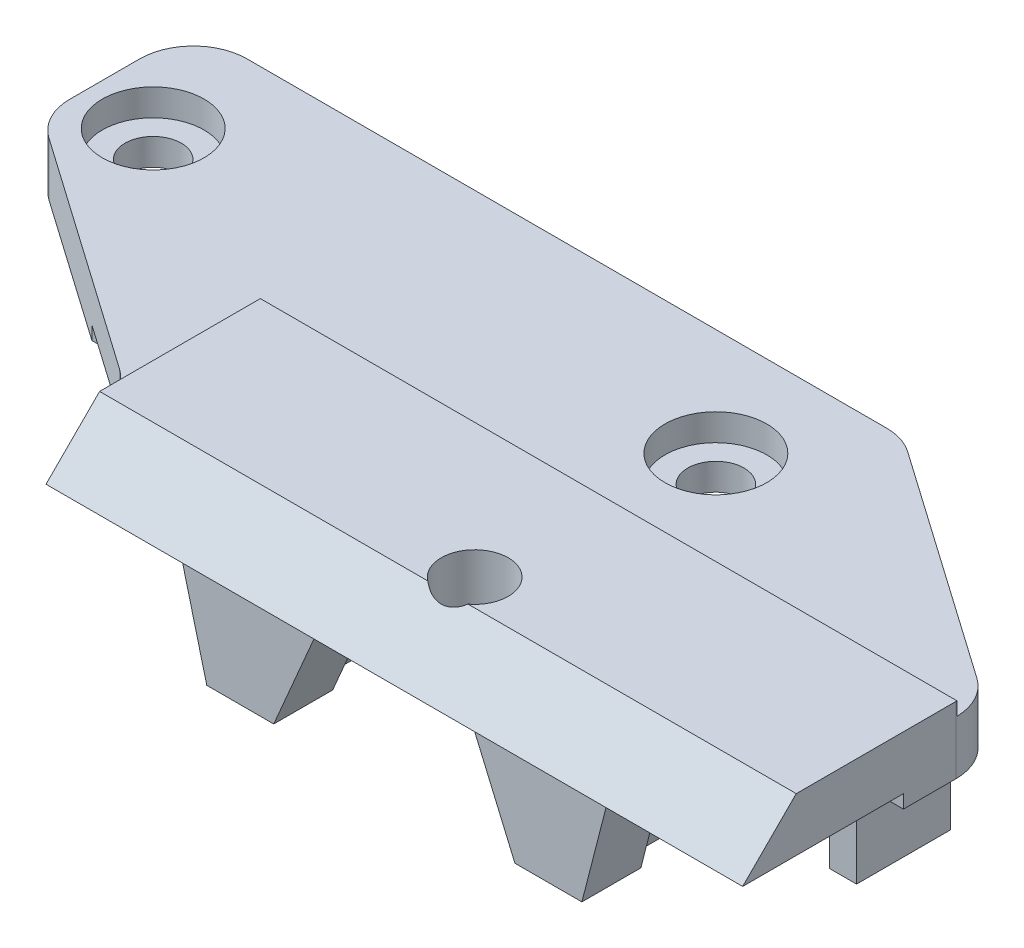
from build123d import *

# Parameters (mm, degrees)
EXTRUDE_1_DEPTH              = 2
EXTRUDE_3_DEPTH              = 6
CUT_EXTRUDE_1_REACH          = 27.426
SKETCH_5_R                   = 1.25
EXTRUDE_4_REACH              = 39.53
SKETCH_6_W                   = 10
SKETCH_6_H                   = 0.5
CUT_EXTRUDE_2_REACH          = 39.53
SKETCH_7_W                   = 8
SKETCH_7_H                   = 0.5
SKETCH_10_W                  = 1
SKETCH_10_H                  = 3.5
EXTRUDE_5_DEPTH              = 3.3
CHAMFER_1_SIZE               = 2
CUT_EXTRUDE_3_REACH          = 27.114
CUT_EXTRUDE_4_DEPTH          = 0.5
HOLE_WIZARD_M2_2_D           = 2.1
HOLE_WIZARD_M2_2_CBORE_D     = 3.8
HOLE_WIZARD_M2_2_CBORE_DEPTH = 1
FILLET_3_R                   = 2
CUT_EXTRUDE_5_DEPTH          = 0.8


with BuildPart() as part:
    # ｽｹｯﾁ1 → ﾎﾞｽ - 押し出し1 (new body)
    with BuildSketch(Plane(origin=(0, 0, 0), x_dir=(1, 0, 0), z_dir=(0, 1, 0))):
        Polygon((-13, 8), (3, 8), (13, 1), (13, -8), (-13, -8), (-13, -5), (-23.5, 2.35), (-23.5, 8), align=None)
    extrude(amount=EXTRUDE_1_DEPTH)

    # ｽｹｯﾁ4 → ﾎﾞｽ - 押し出し3 (add)
    with BuildSketch(Plane.XY.offset(8)):
        Polygon((-7, -3.5), (-4.5, -3.5), (-3, 0), (-7.9, 0), align=None)
        Polygon((3, 0), (4.5, -3.5), (7, -3.5), (7.9, 0), align=None)
    extrude(amount=-EXTRUDE_3_DEPTH)

    # ｽｹｯﾁ5 → ｶｯﾄ - 押し出し1 (cut, up to next)
    with BuildSketch(Plane(origin=(0, 2, 0), x_dir=(1, 0, 0), z_dir=(0, 1, 0)), mode=Mode.PRIVATE) as cut_extrude_1_sk1:
        with Locations(Location((0, -5, 0), (0, 0, 270))):
            Circle(SKETCH_5_R)
    cut_extrude_1_tool1 = extrude(cut_extrude_1_sk1.sketch, amount=-CUT_EXTRUDE_1_REACH, mode=Mode.PRIVATE) & part.part
    add(cut_extrude_1_tool1.solids().sort_by_distance((0, 2, 5))[0], mode=Mode.SUBTRACT)

    # ﾎﾞｽ - 押し出し4: up to this face of the body (flat: up to its plane)
    extrude_4_end = Plane(part.part.faces().sort_by_distance((-23.5, 1, -5.175))[0])
    # ｽｹｯﾁ6 → ﾎﾞｽ - 押し出し4 (add, up to the picked face)
    with BuildSketch(Plane(origin=(13, 0, 0), x_dir=(0, 0, -1), z_dir=(1, 0, 0)), mode=Mode.PRIVATE) as extrude_4_sk1:
        with Locations((3, -0.25)):
            Rectangle(SKETCH_6_W, SKETCH_6_H)
    extrude_4_tool1 = split(extrude(extrude_4_sk1.sketch, amount=-EXTRUDE_4_REACH, mode=Mode.PRIVATE), bisect_by=extrude_4_end, keep=Keep.BOTH, mode=Mode.PRIVATE)
    add(extrude_4_tool1.solids().sort_by(Axis((13, -0.25, -3), (-1, 0, 0)))[0])

    # ｽｹｯﾁ7 → ｶｯﾄ - 押し出し2 (cut, up to next)
    with BuildSketch(Plane(origin=(13, 0, 0), x_dir=(0, 0, -1), z_dir=(1, 0, 0)), mode=Mode.PRIVATE) as cut_extrude_2_sk1:
        with Locations((4, 1.75)):
            Rectangle(SKETCH_7_W, SKETCH_7_H)
    cut_extrude_2_tool1 = extrude(cut_extrude_2_sk1.sketch, amount=-CUT_EXTRUDE_2_REACH, mode=Mode.PRIVATE) & part.part
    add(cut_extrude_2_tool1.solids().sort_by_distance((13, 1.75, -4))[0], mode=Mode.SUBTRACT)

    # ｽｹｯﾁ10 → ﾎﾞｽ - 押し出し5 (add)
    with BuildSketch(Plane.XZ.offset(0.5)):
        with Locations((10.75, 0.25)):
            Rectangle(SKETCH_10_W, SKETCH_10_H)
    extrude_5 = extrude(amount=EXTRUDE_5_DEPTH)

    # ﾐﾗｰ1: ﾎﾞｽ - 押し出し5 across plane
    add(extrude_5.mirror(Plane(origin=(0, 0, 0), x_dir=(0, 0, 1), z_dir=(1, 0, 0))))

    # 面取り1
    # the kernel refuses this chamfer: 2 mm, written as the material it takes off along each edge
    with BuildSketch(Plane(origin=(18.143365976, 2, 8), x_dir=(0, -0.9996219169112968, 0.027495876610586494), z_dir=(-1, 0, 0))) as chamfer_1_piece_1:
        Polygon((CHAMFER_1_SIZE * 0.999621916911, -CHAMFER_1_SIZE * 0.0274958766106), (-CHAMFER_1_SIZE * 0.0274958766106, -CHAMFER_1_SIZE * 0.999621916911), (0, 0), align=None)
    extrude(amount=36.286731952, mode=Mode.SUBTRACT)

    # ｽｹｯﾁ12 → ｶｯﾄ - 押し出し3 (cut, up to next)
    with BuildSketch(Plane(origin=(0, 0, 0), x_dir=(1, 0, 0), z_dir=(0, 1, 0)), mode=Mode.PRIVATE) as cut_extrude_3_sk1:
        Polygon((3, 8), (13, 8), (13, 1), align=None)
    cut_extrude_3_tool1 = extrude(cut_extrude_3_sk1.sketch, amount=-CUT_EXTRUDE_3_REACH, mode=Mode.PRIVATE) & part.part
    # ｽｹｯﾁ12 → ｶｯﾄ - 押し出し3 (cut, up to next)
    with BuildSketch(Plane(origin=(0, 0, 0), x_dir=(1, 0, 0), z_dir=(0, 1, 0)), mode=Mode.PRIVATE) as cut_extrude_3_sk2:
        Polygon((-23.5, -2), (-17.285714286, -2), (-23.5, 2.35), align=None)
    cut_extrude_3_tool2 = extrude(cut_extrude_3_sk2.sketch, amount=-CUT_EXTRUDE_3_REACH, mode=Mode.PRIVATE) & part.part
    add(cut_extrude_3_tool1.solids().sort_by_distance((9.666667, 0, -5.666667))[0], mode=Mode.SUBTRACT)
    add(cut_extrude_3_tool2.solids().sort_by_distance((-21.428571, 0, 0.55))[0], mode=Mode.SUBTRACT)

    # ｽｹｯﾁ13 → ｶｯﾄ - 押し出し4 (cut)
    with BuildSketch(Plane(origin=(0, 2, 0), x_dir=(1, 0, 0), z_dir=(0, 1, 0))):
        Polygon((-13, -5), (-13, 0), (-20.142857143, 0), align=None)
    extrude(amount=-CUT_EXTRUDE_4_DEPTH, mode=Mode.SUBTRACT)

    # M2 丸平ねじ用座ぐり穴2 (through all)
    with Locations(Plane(origin=(0, 1.5, 0), x_dir=(1, 0, 0), z_dir=(0, 1, 0))):
        with Locations((-21, 4), (0, 4)):
            CounterBoreHole(HOLE_WIZARD_M2_2_D / 2, HOLE_WIZARD_M2_2_CBORE_D / 2, HOLE_WIZARD_M2_2_CBORE_DEPTH)

    # ﾌｨﾚｯﾄ3
    fillet_3_edges = [part.edges().sort_by_distance(p)[0] for p in [
        (-13, 0.75, 5),
        (13, 0.5, -1),
        (3, 0.5, -8),
        (-23.5, 0.5, -8),
        (-23.5, 0.5, -2.35),
    ]]
    fillet(fillet_3_edges, radius=FILLET_3_R)

    # ｽｹｯﾁ16 → ｶｯﾄ - 押し出し5 (cut, symmetric)
    with BuildSketch(Plane.XY.offset(5)):
        Polygon((-7.9, 0), (-7, -3.5), (-6.4, -3.5), (-7.3, 0), align=None)
        Polygon((-3, 0), (-4.5, -3.5), (-5.1, -3.5), (-3.6, 0), align=None)
        Polygon((3, 0), (4.5, -3.5), (5.1, -3.5), (3.6, 0), align=None)
        Polygon((7.9, 0), (7, -3.5), (6.4, -3.5), (7.3, 0), align=None)
    extrude(amount=CUT_EXTRUDE_5_DEPTH, both=True, mode=Mode.SUBTRACT)


solid = part.part
